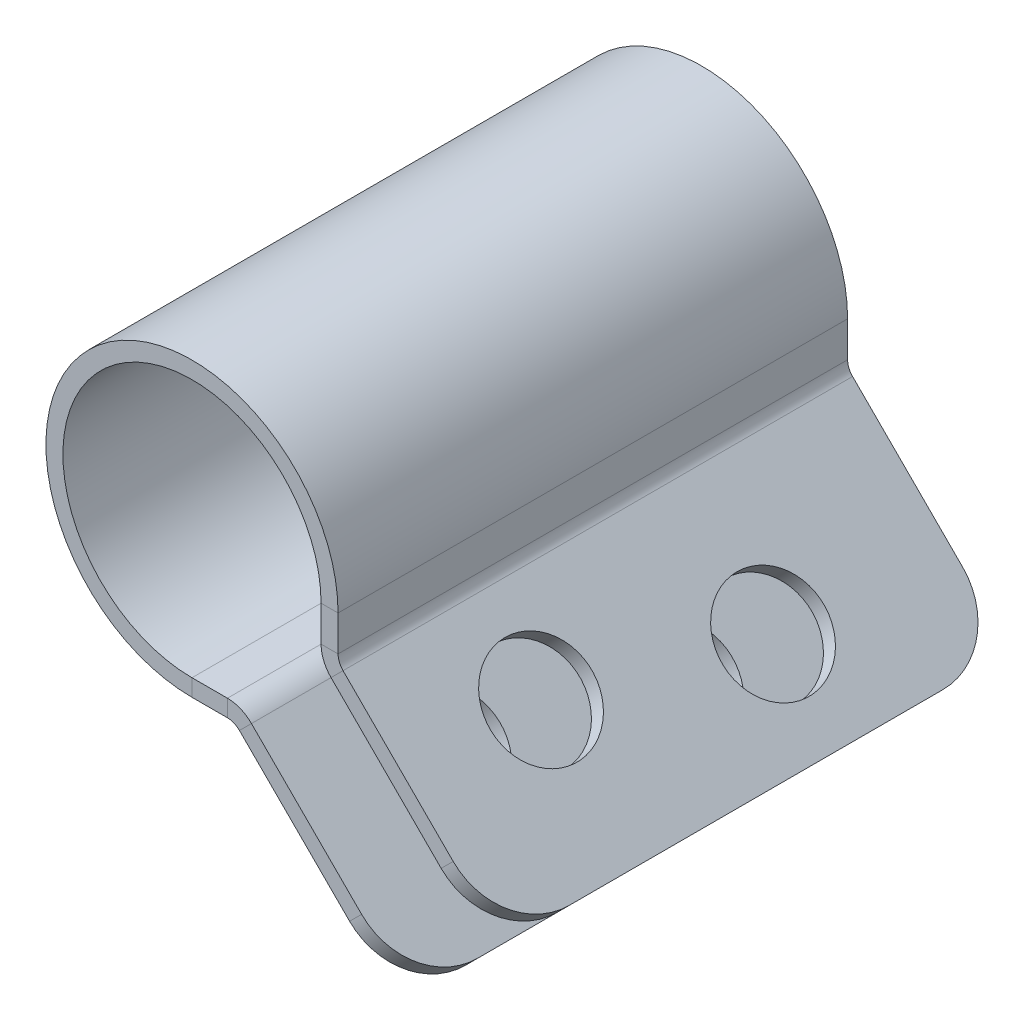
from build123d import *

# Parameters (mm, degrees)
SKETCH_1_W               = 23
SKETCH_1_H               = 15
EXTRUDE_1_DEPTH          = 0.5
OTHER_START              = -7.5
OTHER_1_DEPTH            = 15
OTHER_1_2_DEPTH          = 15
SM_START                 = -7.5
SM_EDGE_FLANGE_1_DEPTH   = 15
SM_EDGE_FLANGE_1_2_DEPTH = 15
FILLET_1_R               = 2
SKETCH_16_R              = 1.5
CUT_EXTRUDE_1_DEPTH      = 10


# Read off the part's stored shape, not the designer's step: Нарисованный сгиб1, Ребро-кромка1
with BuildPart() as part:
    # Sketch 1 → Бобышка-Вытянуть1 (new body)
    with BuildSketch(Plane(origin=(0, 0, 0), x_dir=(1, 0, 0), z_dir=(0, 1, 0))):
        with Locations((-9.5, 0)):
            Rectangle(SKETCH_1_W, SKETCH_1_H)
    extrude(amount=EXTRUDE_1_DEPTH)

    # Other 1 outline → Other 1 (cut)
    with BuildSketch(Plane.XY.offset(OTHER_START)):
        with BuildLine():
            ThreePointArc((0.042587685, 0), (-0.994234383, 0.126871677), (-1.969873495, 0.5))
            Line((-1.969873495, 0.5), (-21, 0.5))
            Line((-21, 0.5), (-21, 0))
            Line((-21, 0), (0.042587685, 0))
        make_face()
    extrude(amount=OTHER_1_DEPTH, mode=Mode.SUBTRACT)

    # Other 1 2 outline → Other 1 2 (add)
    with BuildSketch(Plane.XY.offset(OTHER_START)):
        with BuildLine():
            ThreePointArc((0.042587685, 0.5), (-2.644418083, 6.987005769), (3.842587685, 4.3))
            Line((3.842587685, 4.3), (3.842587685, 2.342587685))
            Line((3.842587685, 2.342587685), (4.342587685, 2.342587685))
            Line((4.342587685, 2.342587685), (4.342587685, 4.3))
            ThreePointArc((4.342587685, 4.3), (-2.175115736, 7.983991251), (-1.969873495, 0.5))
            Line((-1.969873495, 0.5), (0.042587685, 0.5))
        make_face()
    extrude(amount=OTHER_1_2_DEPTH)

    # Ребро-кромка1 outline → Ребро-кромка1 (cut)
    with BuildSketch(Plane.XY.offset(SM_START)):
        with BuildLine():
            ThreePointArc((1.085786438, 0.5), (1.46846987, 0.423879533), (1.792893219, 0.207106781))
            Line((1.792893219, 0.207106781), (2, 0))
            Line((2, 0), (2, 0.5))
            Line((2, 0.5), (1.085786438, 0.5))
        make_face()
        with BuildLine():
            Line((3.842587685, 2.342587685), (4.342587685, 2.342587685))
            Line((4.342587685, 2.342587685), (4.135480904, 2.549694466))
            ThreePointArc((4.135480904, 2.549694466), (3.918708153, 2.874117815), (3.842587685, 3.256801248))
            Line((3.842587685, 3.256801248), (3.842587685, 2.342587685))
        make_face()
    extrude(amount=SM_EDGE_FLANGE_1_DEPTH, mode=Mode.SUBTRACT)

    # Sm Edge Flange 1 2 outline → Sm Edge Flange 1 2 (add)
    with BuildSketch(Plane.XY.offset(SM_START)):
        with BuildLine():
            Line((6.449747468, -4.449747468), (2, 0))
            Line((2, 0), (1.085786438, 0))
            ThreePointArc((1.085786438, 0), (1.277128154, -0.038060234), (1.439339828, -0.146446609))
            Line((1.439339828, -0.146446609), (6.096194078, -4.803300859))
            Line((6.096194078, -4.803300859), (6.449747468, -4.449747468))
        make_face()
        with BuildLine():
            Line((8.792335154, -2.107159783), (9.145888544, -1.753606392))
            Line((9.145888544, -1.753606392), (4.489034295, 2.903247857))
            ThreePointArc((4.489034295, 2.903247857), (4.380647919, 3.065459531), (4.342587685, 3.256801248))
            Line((4.342587685, 3.256801248), (4.342587685, 2.342587685))
            Line((4.342587685, 2.342587685), (8.792335154, -2.107159783))
        make_face()
    extrude(amount=SM_EDGE_FLANGE_1_2_DEPTH)

    # Скругление1
    fillet_1_edges = [part.edges().sort_by_distance(p)[0] for p in [
        (8.969111849, -1.930383088, 7.5),
        (8.969111849, -1.930383088, -7.5),
        (6.272970773, -4.626524164, -7.5),
        (6.272970773, -4.626524164, 7.5),
    ]]
    fillet(fillet_1_edges, radius=FILLET_1_R)

    # Эскиз16 → Вырез-Вытянуть1 (cut)
    with BuildSketch(Plane(origin=(3.696141076, 3.696141076, 0), x_dir=(0, 0, -1), z_dir=(0.7071067811865587, 0.7071067811865365, 0))):
        with Locations(Location((2.46, -4.937106781, 0), (0, 0, 90))):
            Circle(SKETCH_16_R)
        with Locations(Location((-3.5, -3.707106781, 0), (0, 0, 90))):
            Circle(SKETCH_16_R)
    extrude(amount=-CUT_EXTRUDE_1_DEPTH, mode=Mode.SUBTRACT)


solid = part.part
